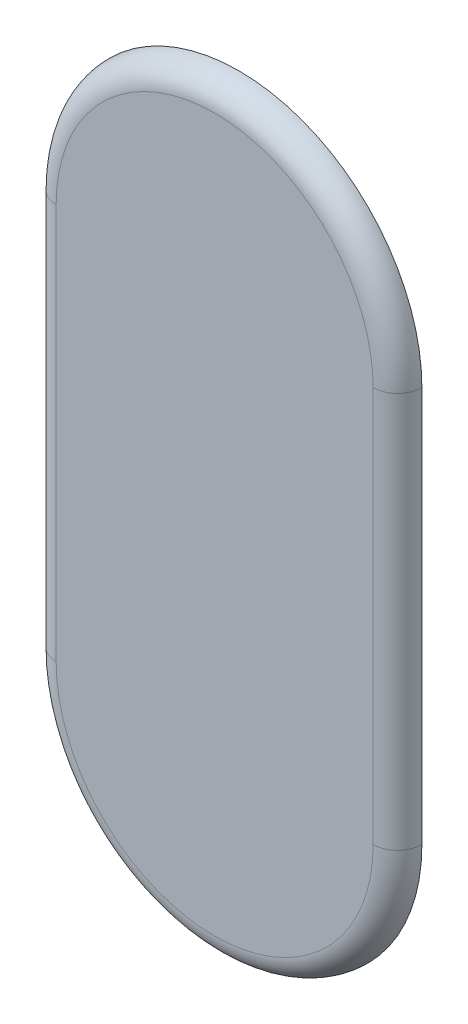
from build123d import *

# Parameters (mm, degrees)
BOSS_EXTRU_1_DEPTH = 10
CONG_1_R           = 10


with BuildPart() as part:
    # Esquisse1 → Boss.-Extru.1 (new body)
    with BuildSketch(Plane.XY):
        with BuildLine():
            ThreePointArc((75, 0), (0, -75), (-75, 0))
            Line((-75, 0), (-75, -162.276597369))
            ThreePointArc((-75, -162.276597369), (0, -87.276597369), (75, -162.276597369))
            Line((75, -162.276597369), (75, 0))
        make_face()
        with BuildLine():
            ThreePointArc((75, 0), (0, 75), (-75, 0))
            Line((-75, 0), (75, 0))
        make_face()
        with BuildLine():
            Line((75, 0), (-75, 0))
            ThreePointArc((-75, 0), (0, -75), (75, 0))
        make_face()
        with BuildLine():
            ThreePointArc((75, -162.276597369), (0, -87.276597369), (-75, -162.276597369))
            Line((-75, -162.276597369), (75, -162.276597369))
        make_face()
        with BuildLine():
            Line((75, -162.276597369), (-75, -162.276597369))
            ThreePointArc((-75, -162.276597369), (0, -237.276597369), (75, -162.276597369))
        make_face()
    extrude(amount=BOSS_EXTRU_1_DEPTH)

    # Congé1
    cong_1_edges = [part.edges().sort_by_distance(p)[0] for p in [
        (0, 75, 10),
        (75, -81.138298684, 10),
        (0, -237.276597369, 10),
        (-75, -81.138298684, 10),
    ]]
    fillet(cong_1_edges, radius=CONG_1_R - 0.0001)  # a hair under: the kernel refuses the full size


solid = part.part
